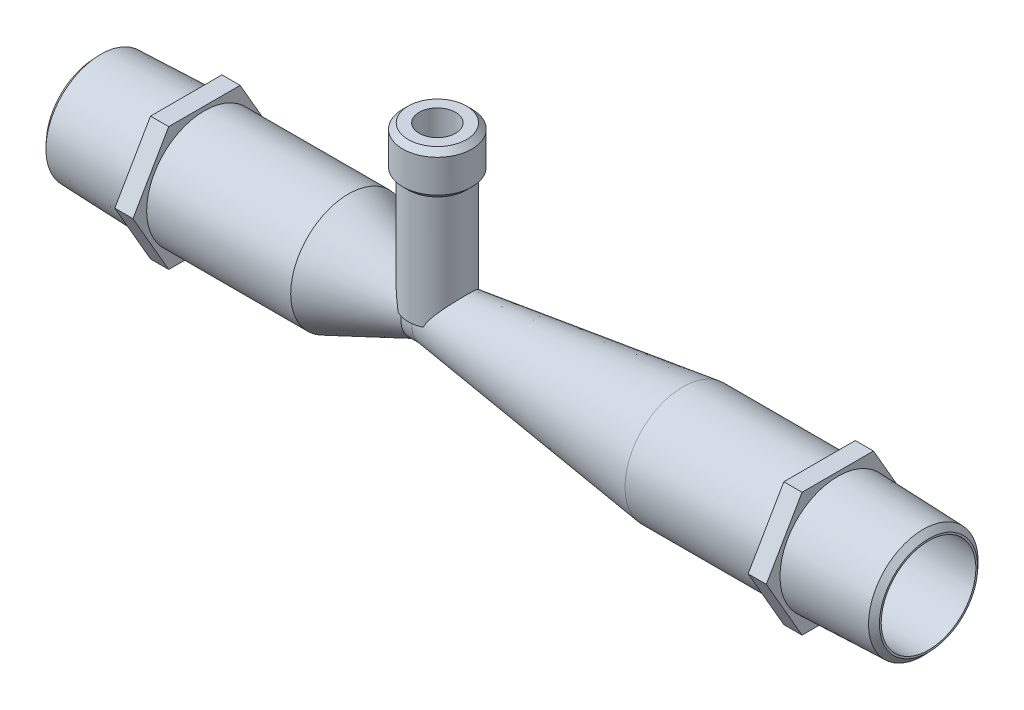
from build123d import *

# Parameters (mm, degrees)
SKETCH2_R           = 13.003199109
BOSS_EXTRUDE1_DEPTH = 5
BOSS_EXTRUDE2_START = -5
SKETCH3_R           = 13.003199109
BOSS_EXTRUDE2_DEPTH = 5
CHAMFER1_SIZE       = 1.5
CUT_EXTRUDE1_REACH  = 139.423
SKETCH4_R           = 4
CHAMFER2_SIZE       = 1.5
SKETCH7_R           = 5
CUT_EXTRUDE2_DEPTH  = 10
CUT_EXTRUDE2_DRAFT  = 14
SKETCH7_2_R         = 5
CUT_EXTRUDE3_DEPTH  = 10
CUT_EXTRUDE3_DRAFT  = -7
SCALE1_SCALE        = 2


with BuildPart() as part:
    # Sketch1 → Revolve-Thin1 (revolve)
    with BuildSketch(Plane.XY, mode=Mode.PRIVATE) as revolve_thin1_sk:
        Polygon((-94, 15.001980763), (-69, 15.875), (-24.426145366, 15.875), (-3, 7), (0, 7), (67.41231775, 15.875), (110, 15.875), (135, 15.001980763), (134.930201007, 13.003199109), (109.96508987, 13.875), (67.543404676, 13.875), (0.131086926, 5), (-3.397824735, 5), (-24.823970101, 13.875), (-68.96508987, 13.875), (-93.930201007, 13.003199109), align=None)
    revolve(revolve_thin1_sk.sketch.rotate(Axis((-94, 0, 0), (1, 0, 0)), 90), axis=Axis((-94, 0, 0), (1, 0, 0)))

    # Sketch2 → Boss-Extrude1 (add)
    with BuildSketch(Plane(origin=(-69, 0, 0), x_dir=(0, 0, -1), z_dir=(1, 0, 0))):
        Polygon((19.629909152, 0), (9.814954576, 17), (-9.814954576, 17), (-19.629909152, 0), (-9.814954576, -17), (9.814954576, -17), align=None)
        Circle(SKETCH2_R, mode=Mode.SUBTRACT)
    extrude(amount=BOSS_EXTRUDE1_DEPTH)

    # Sketch3 → Boss-Extrude2 (add)
    with BuildSketch(Plane(origin=(110, 0, 0), x_dir=(0, 0, -1), z_dir=(1, 0, 0)).offset(BOSS_EXTRUDE2_START)):
        Polygon((19.629909152, 0), (9.814954576, 17), (-9.814954576, 17), (-19.629909152, 0), (-9.814954576, -17), (9.814954576, -17), align=None)
        Circle(SKETCH3_R, mode=Mode.SUBTRACT)
    extrude(amount=BOSS_EXTRUDE2_DEPTH)

    # Chamfer1
    chamfer1_edges = [part.edges().sort_by_distance(p)[0] for p in [
        (135, 0, -15.001980763),
        (-94, 0, -15.001980763),
    ]]
    chamfer(chamfer1_edges, length=CHAMFER1_SIZE)

    # Sketch4 → Cut-Extrude1 (cut, up to next)
    with BuildSketch(Plane(origin=(0, 0, 0), x_dir=(1, 0, 0), z_dir=(0, 1, 0)), mode=Mode.PRIVATE) as cut_extrude1_sk1:
        with Locations(Location((0, 0, 0), (0, 0, 90))):
            Circle(SKETCH4_R)
    cut_extrude1_tool1 = extrude(cut_extrude1_sk1.sketch, amount=CUT_EXTRUDE1_REACH, mode=Mode.PRIVATE) & part.part
    add(cut_extrude1_tool1.solids().sort_by_distance((0, 0, 0))[0], mode=Mode.SUBTRACT)

    # Sketch5 → Revolve3 (revolve)
    with BuildSketch(Plane.XY, mode=Mode.PRIVATE) as revolve3_sk:
        Polygon((-4, 0), (-8, 1.656854249), (-8, 33), (-9.5, 33), (-9.5, 45), (-5, 45), (-5, 10.414213562), (-4, 10), align=None)
    revolve(revolve3_sk.sketch.rotate(Axis((0, 0, 0), (0, 1, 0)), 270), axis=Axis((0, 0, 0), (0, 1, 0)))

    # Chamfer2
    chamfer2_edges = [part.edges().sort_by_distance(p)[0] for p in [
        (0, 33, 9.5),
        (0, 45, 9.5),
    ]]
    chamfer(chamfer2_edges, length=CHAMFER2_SIZE - 0.0001)  # a hair under: the kernel refuses the full size


with BuildPart() as cut_extrude2_tool:
    # Sketch7 → Cut-Extrude2 (with draft: the straight prism first)
    with BuildSketch(Plane(origin=(0, 0, 0), x_dir=(0, 0, -1), z_dir=(1, 0, 0))):
        Circle(SKETCH7_R)
    extrude(amount=-CUT_EXTRUDE2_DEPTH)
    # Cut-Extrude2: the draft: its side faces are tilted about the plane it starts from
    cut_extrude2_sides = [cut_extrude2_tool.faces().sort_by_distance(p)[0] for p in [
        (-5, 0, 5),
    ]]
    draft(cut_extrude2_sides, Plane(origin=(0, 0, 0), x_dir=(0, 0, -1), z_dir=(1, 0, 0)), CUT_EXTRUDE2_DRAFT)


with BuildPart() as part_1:
    add(part.part)

    # Cut-Extrude2: cut by cut_extrude2_tool
    add(cut_extrude2_tool.part, mode=Mode.SUBTRACT)


with BuildPart() as cut_extrude3_tool:
    # Sketch7<2> → Cut-Extrude3 (with draft: the straight prism first)
    with BuildSketch(Plane(origin=(0, 0, 0), x_dir=(0, 0, -1), z_dir=(1, 0, 0))):
        Circle(SKETCH7_2_R)
    extrude(amount=CUT_EXTRUDE3_DEPTH)
    # Cut-Extrude3: the draft: its side faces are tilted about the plane it starts from
    cut_extrude3_sides = [cut_extrude3_tool.faces().sort_by_distance(p)[0] for p in [
        (5, 0, 5),
    ]]
    draft(cut_extrude3_sides, Plane(origin=(0, 0, 0), x_dir=(0, 0, -1), z_dir=(1, 0, 0)), CUT_EXTRUDE3_DRAFT)


with BuildPart() as part_2:
    add(part_1.part)

    # Cut-Extrude3: cut by cut_extrude3_tool
    add(cut_extrude3_tool.part, mode=Mode.SUBTRACT)


with BuildPart() as part_3:
    # Scale1: scaled about (18.680604314, 3.407991009, 5.57e-07)
    add(part_2.part.scale(SCALE1_SCALE).moved(Location((-18.680604314, -3.407991009, -5.57e-07))))


solid = part_3.part
